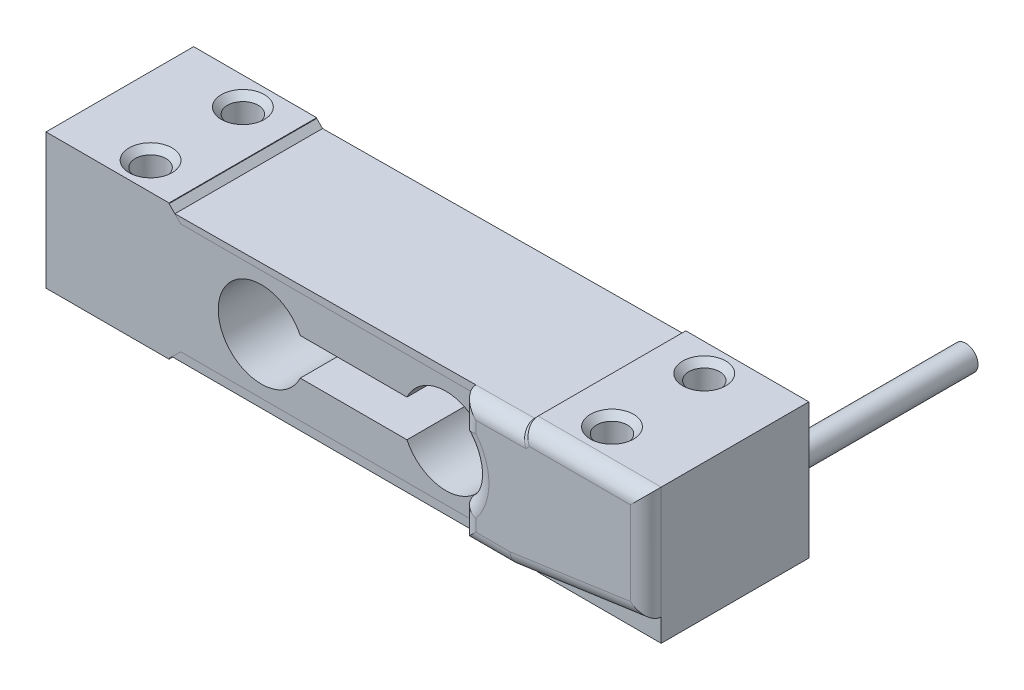
from build123d import *

# Parameters (mm, degrees)
EXTRUDE_1_DEPTH    = 12
HOLE_WIZARD_M6_1_D = 5
CHAMFER_1_SIZE     = 1
EXTRUDE_2_DEPTH    = 24
EXTRUDE_2_2_DEPTH  = 24
EXTRUDE_3_DEPTH    = 2.5
FILLET_1_R         = 2.5
SKETCH_6_R         = 2
EXTRUDE_4_DEPTH    = 30


with BuildPart() as part:
    # 草图1 → 凸台-拉伸1 (new, symmetric)
    with BuildSketch(Plane.XY):
        Polygon((-30, 10.9), (-30, 11), (-50, 11), (-50, -11), (-30, -11), (-30, -10.9), (-28.1, -9), (28.1, -9), (30, -10.9), (30, -11), (50, -11), (50, 11), (30, 11), (30, 10.9), (28.1, 9), (-28.1, 9), align=None)
        with BuildLine():
            Line((-8.67544468, 3), (8.67544468, 3))
            ThreePointArc((8.67544468, 3), (22, 0), (8.67544468, -3))
            Line((8.67544468, -3), (-8.67544468, -3))
            ThreePointArc((-8.67544468, -3), (-22, 0), (-8.67544468, 3))
        make_face(mode=Mode.SUBTRACT)
    extrude(amount=EXTRUDE_1_DEPTH, both=True)

    # M6 螺纹孔1 (through all)
    with Locations(Plane(origin=(-37.5, 11, -7.5), x_dir=(1, 0, 0), z_dir=(0, 1, 0))):
        with Locations((0, 0), (0, -15), (75, 0), (75, -15)):
            Hole(HOLE_WIZARD_M6_1_D / 2)

    # 倒角1
    chamfer_1_edges = [part.edges().sort_by_distance(p)[0] for p in [
        (40, 11, 7.5),
        (40, -11, 7.5),
        (40, 11, -7.5),
        (40, -11, -7.5),
        (-35, 11, 7.5),
        (-35, -11, 7.5),
        (-35, 11, -7.5),
        (-35, -11, -7.5),
    ]]
    chamfer(chamfer_1_edges, length=CHAMFER_1_SIZE)

    # 草图6 → 凸台-拉伸4 (add)
    with BuildSketch(Plane(origin=(0, 0, -12), x_dir=(-1, 0, 0), z_dir=(0, 0, -1))):
        with Locations((-45.5, 0)):
            Circle(SKETCH_6_R)
    extrude(amount=EXTRUDE_4_DEPTH)


with BuildPart() as body_2:
    # 草图4 → 凸台-拉伸2 (new body)
    with BuildSketch(Plane.XY.offset(12)):
        Polygon((28.1, 9), (29.5, 10.4), (-29.05, 9.95), (-28.1, 9), align=None)
    extrude(amount=-EXTRUDE_2_DEPTH)


with BuildPart() as body_3:
    # 草图4 → Extrude 2 2 (new body)
    with BuildSketch(Plane.XY.offset(12)):
        Polygon((-29.5, -10.4), (29.5, -10.4), (28.1, -9), (-28.1, -9), align=None)
    extrude(amount=-EXTRUDE_2_2_DEPTH)


with BuildPart() as body_4:
    # 草图5 → 凸台-拉伸3 (new body)
    with BuildSketch(Plane.XY.offset(12)):
        with BuildLine():
            Line((19.871867852, 10.326000692), (19.871867852, 5.026420559))
            ThreePointArc((19.871867852, 5.026420559), (22, 0), (19.871867852, -5.026420559))
            Line((19.871867852, -5.026420559), (19.871867852, -10.4))
            Line((19.871867852, -10.4), (28.1, -10.4))
            Line((28.1, -10.4), (50, -7.276315303))
            Line((50, -7.276315303), (50, 11))
            Line((50, 11), (30, 11))
            Line((30, 11), (29.429485139, 10.399458041))
            Line((29.429485139, 10.399458041), (19.871867852, 10.326000692))
        make_face()
    extrude(amount=EXTRUDE_3_DEPTH)

    # 圆角1
    fillet_1_edges = [body_4.edges().sort_by_distance(p)[0] for p in [
        (29.71474257, 10.699729021, 14.5),
        (40, 11, 14.5),
        (50, 1.861842348, 14.5),
        (22, 0, 14.5),
        (23.985933926, -10.4, 14.5),
        (19.871867852, -7.713210279, 14.5),
        (19.871867852, 7.676210625, 14.5),
        (24.650676496, 10.362729367, 14.5),
        (39.05, -8.838157652, 14.5),
    ]]
    fillet(fillet_1_edges, radius=FILLET_1_R - 0.0001)  # a hair under: the kernel refuses the full size


solid = Compound([part.part, body_2.part, body_3.part, body_4.part])
